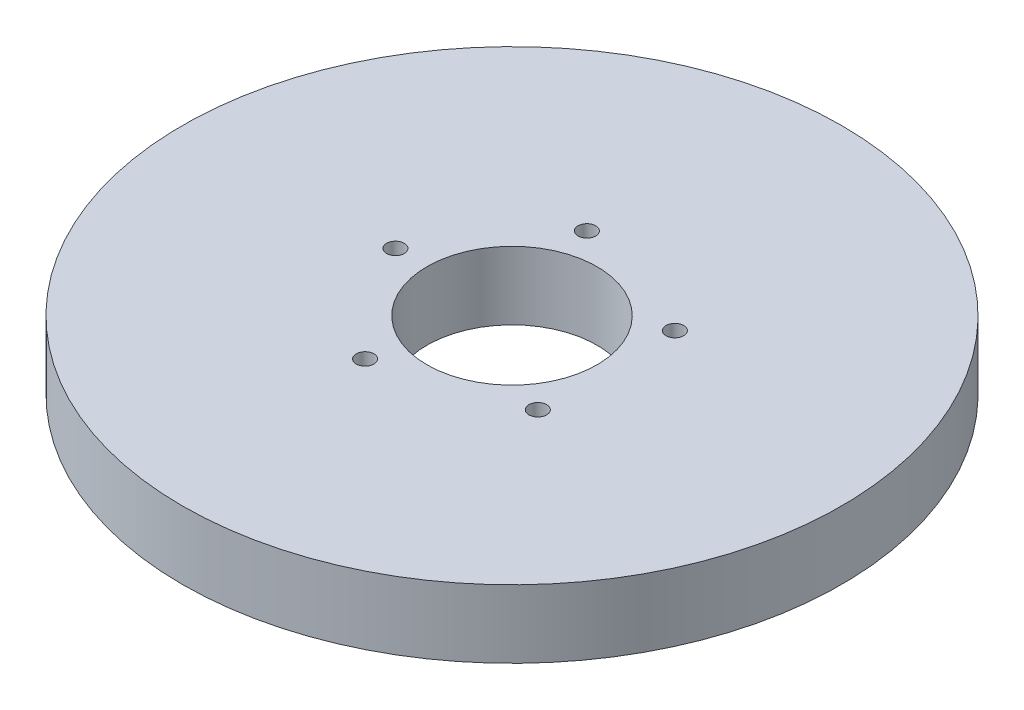
from build123d import *

# Parameters (mm, degrees)
SKETCH1_R           = 77.5
BOSS_EXTRUDE1_DEPTH = 16
SKETCH2_R           = 20
CUT_EXTRUDE1_DEPTH  = 111.763261057
SKETCH3_R           = 2.086068246
CUT_EXTRUDE2_DEPTH  = 14.2762386
CIRPATTERN1_COUNT   = 5


with BuildPart() as part:
    # Sketch1 → Boss-Extrude1 (new body)
    with BuildSketch(Plane(origin=(0, 0, 0), x_dir=(1, 0, 0), z_dir=(0, 1, 0))):
        Circle(SKETCH1_R)
    extrude(amount=BOSS_EXTRUDE1_DEPTH)

    # Sketch2 → Cut-Extrude1 (cut, through all)
    with BuildSketch(Plane(origin=(0, 0, 0), x_dir=(1, 0, 0), z_dir=(0, 1, 0))):
        Circle(SKETCH2_R)
    extrude(amount=CUT_EXTRUDE1_DEPTH, mode=Mode.SUBTRACT)

    # Sketch3 → Cut-Extrude2 (cut)
    with BuildSketch(Plane(origin=(0, 16, 0), x_dir=(1, 0, 0), z_dir=(0, 1, 0))):
        with Locations((-27.419260257, 0)):
            Circle(SKETCH3_R)
    cut_extrude2 = extrude(amount=-CUT_EXTRUDE2_DEPTH, mode=Mode.SUBTRACT)

    # CirPattern1: Cut-Extrude2 ×5 about axis
    cirpattern1_axis = Axis((0, 0, 0), (0, 1, 0))
    for i in range(1, CIRPATTERN1_COUNT):
        add(cut_extrude2.rotate(cirpattern1_axis, i * 360 / CIRPATTERN1_COUNT), mode=Mode.SUBTRACT)


solid = part.part
